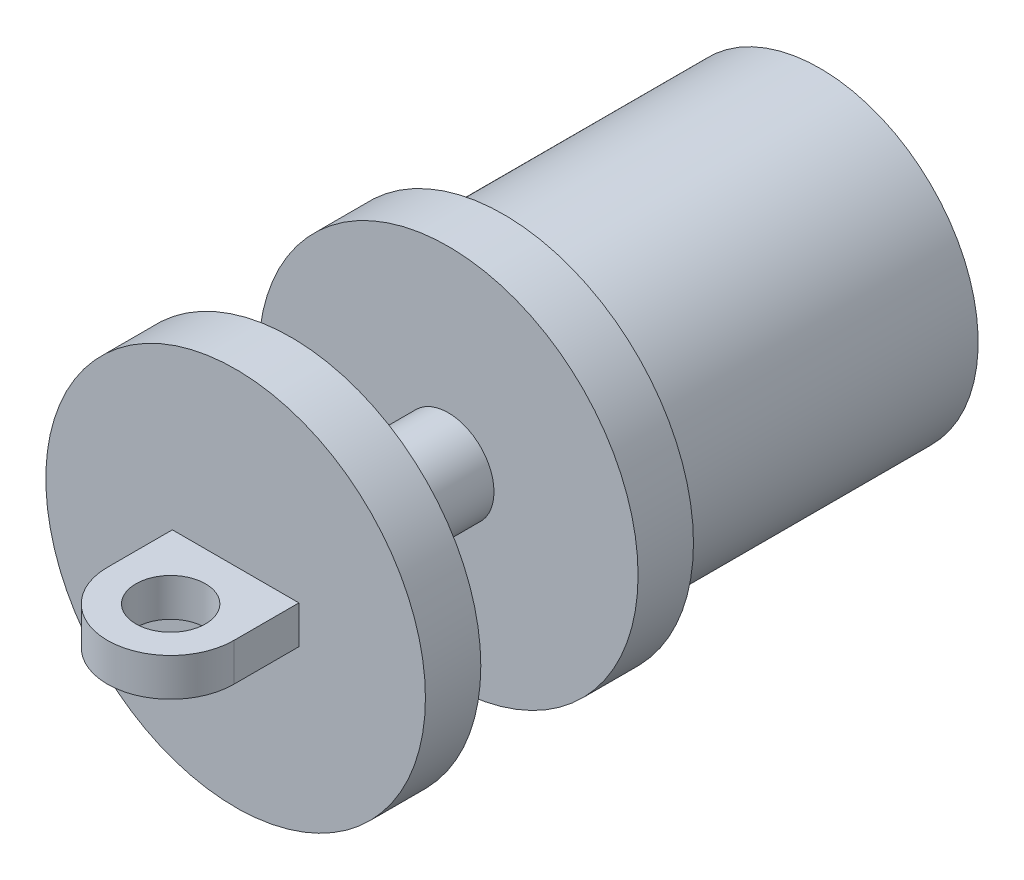
from build123d import *

# Parameters (mm, degrees)
SKETCH4_R           = 2.75
BOSS_EXTRUDE1_DEPTH = 1.5
SKETCH5_R           = 12.5
BOSS_EXTRUDE2_DEPTH = 25


with BuildPart() as part:
    # Sketch3 → Revolve2 (revolve)
    with BuildSketch(Plane(origin=(0, 0, 0), x_dir=(0, 0, -1), z_dir=(1, 0, 0))):
        Polygon((-6.214618974, 3.611197512), (6.214618974, 3.611197512), (6.214618974, 15), (10.590979782, 15), (10.590979782, 0), (-10.590979782, 0), (-10.590979782, 15), (-6.214618974, 15), align=None)
    revolve(axis=Axis((0, 0, 10.590979782), (0, 0, -1)))

    # Sketch4 → Boss-Extrude1 (add, symmetric)
    with BuildSketch(Plane(origin=(0, 0, 0), x_dir=(1, 0, 0), z_dir=(0, 1, 0))):
        with BuildLine():
            Line((-5, -15.723809824), (-5, -10.590979782))
            Line((-5, -10.590979782), (5, -10.590979782))
            Line((5, -10.590979782), (5, -15.723809824))
            ThreePointArc((5, -15.723809824), (0, -20.723809824), (-5, -15.723809824))
        make_face()
        with Locations((0, -15.723809824)):
            Circle(SKETCH4_R, mode=Mode.SUBTRACT)
    extrude(amount=BOSS_EXTRUDE1_DEPTH, both=True)

    # Sketch5 → Boss-Extrude2 (add)
    with BuildSketch(Plane(origin=(0, 0, -10.590979782), x_dir=(-1, 0, 0), z_dir=(0, 0, -1))):
        Circle(SKETCH5_R)
    extrude(amount=BOSS_EXTRUDE2_DEPTH)


solid = part.part
